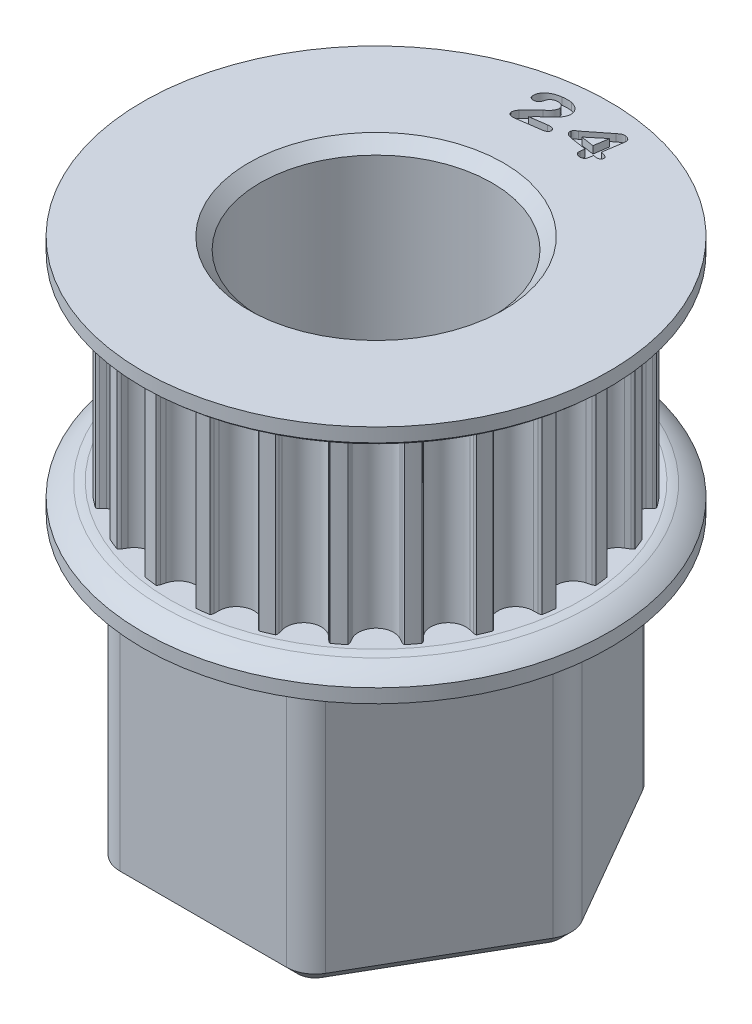
from build123d import *

# Parameters (mm, degrees)
SKETCH1_R                    = 11.078156269
TOOTHOD_DEPTH                = 5.08
TOOTHPROFILE_DEPTH           = 17.469896559
TOOTHPATTERN_COUNT           = 24
BORE_DEPTH                   = 20.343586122
BORE_DEPTH_BACK              = 20.343586122
SKETCH7_R                    = 6.3881
SMALL_TOOTH_COUNT_DEPTH      = 23.472489227
SMALL_TOOTH_COUNT_DEPTH_BACK = 0.4
SKETCH12_R                   = 6.3881
BOSS_EXTRUDE1_DEPTH          = 15.24
FILLET1_R                    = 1.5875
CUT_SWEEP1_PROFILE_R         = 0.3175
FILLET2_R                    = 1.27
CHAMFER2_SIZE                = 0.635
CHAMFER3_SIZE                = 0.635


with BuildPart() as part:
    # Sketch1 → ToothOD (new, symmetric)
    with BuildSketch(Plane(origin=(0, 0, 0), x_dir=(1, 0, 0), z_dir=(0, 1, 0))):
        Circle(SKETCH1_R)
    extrude(amount=TOOTHOD_DEPTH, both=True)

    # Sketch2 → ToothProfile (cut, symmetric)
    with BuildSketch(Plane(origin=(0, 0, 0), x_dir=(1, 0, 0), z_dir=(0, 1, 0))):
        with BuildLine():
            ThreePointArc((-0.937033068, 10.628218265), (-0.590385173, 10.110043655), (0, 9.909756269))
            ThreePointArc((0, 9.909756269), (0.590385173, 10.110043655), (0.937033068, 10.628218265))
            ThreePointArc((0.937033068, 10.628218265), (0.971699064, 10.754329727), (1.007805813, 10.880036269))
            ThreePointArc((1.007805813, 10.880036269), (1.043742495, 10.958436311), (1.100516181, 11.023357495))
            ThreePointArc((1.100516181, 11.023357495), (0, 11.078156269), (-1.100516181, 11.023357495))
            ThreePointArc((-1.100516181, 11.023357495), (-1.043742495, 10.958436311), (-1.007805813, 10.880036269))
            ThreePointArc((-1.007805813, 10.880036269), (-0.971699064, 10.754329727), (-0.937033068, 10.628218265))
        make_face()
    toothprofile = extrude(amount=TOOTHPROFILE_DEPTH, both=True, mode=Mode.SUBTRACT)

    # ToothPattern: ToothProfile ×24 about axis
    toothpattern_axis = Axis((0, 5.08, 0), (0, -1, 0))
    for i in range(1, TOOTHPATTERN_COUNT):
        add(toothprofile.rotate(toothpattern_axis, i * 360 / TOOTHPATTERN_COUNT), mode=Mode.SUBTRACT)

    # Sketch4 → Flange (revolve)
    with BuildSketch(Plane.XY):
        with BuildLine():
            Line((0, -5.08), (11.332156269, -5.08))
            ThreePointArc((11.332156269, -5.08), (11.56180289, -5.115951298), (11.787228598, -5.172637424))
            ThreePointArc((11.787228598, -5.172637424), (12.354957174, -5.454197125), (12.856156269, -5.842))
            Line((12.856156269, -5.842), (12.856156269, -6.604))
            Line((12.856156269, -6.604), (0, -6.604))
            Line((0, -6.604), (0, -5.08))
        make_face()
        with BuildLine():
            Line((12.856156269, 6.604), (12.856156269, 5.842))
            ThreePointArc((12.856156269, 5.842), (12.354957174, 5.454197125), (11.787228598, 5.172637424))
            ThreePointArc((11.787228598, 5.172637424), (11.56180289, 5.115951298), (11.332156269, 5.08))
            Line((11.332156269, 5.08), (0, 5.08))
            Line((0, 5.08), (0, 6.604))
            Line((0, 6.604), (12.856156269, 6.604))
        make_face()
    revolve(axis=Axis((0, 8.0264, 0), (0, -1, 0)))

    # Sketch7 → Bore (cut, two sides: drawn at the far end of the back side and taken through both)
    with BuildSketch(Plane.XZ.offset(-BORE_DEPTH_BACK)):
        Circle(SKETCH7_R)
    extrude(amount=BORE_DEPTH + BORE_DEPTH_BACK, mode=Mode.SUBTRACT)

    # Sketch11 → Small Tooth Count (cut, two sides: drawn at the far end of the back side and taken through both)
    # profile 1 of 2: a face of its own
    with BuildSketch(Plane(origin=(0, 6.604, 0), x_dir=(1, 0, 0), z_dir=(0, 1, 0)).offset(-SMALL_TOOTH_COUNT_DEPTH_BACK)):
        with BuildLine():
            Line((-1.50932721, 9.916837863), (-0.597606116, 10.046764816))
            add(Edge.make_bspline(
                [(-0.597606116, 10.046764816), (-0.571157489, 10.050105826), (-0.52120142, 10.056416311), (-0.449541333, 10.055313599), (-0.385667722, 10.047305308), (-0.330562884, 10.029277348), (-0.28444503, 10.005378402), (-0.249016623, 9.974662726), (-0.224075796, 9.938023746), (-0.217996356, 9.910169852), (-0.214969007, 9.896299582)],
                knots=[0, 0, 0, 0, 1.407436454, 2.658360686, 3.778686155, 4.796186387, 5.707822169, 6.504860125, 7.25547238, 8, 8, 8, 8], degree=3))
            add(Edge.make_bspline(
                [(-0.214969007, 9.896299582), (-0.213936308, 9.883603258), (-0.211851942, 9.857977408), (-0.222454605, 9.819456736), (-0.242047158, 9.78205115), (-0.270462476, 9.745517337), (-0.309742938, 9.712270871), (-0.360197484, 9.685833025), (-0.421026872, 9.665765439), (-0.465453114, 9.658287244), (-0.489110413, 9.654305051)],
                knots=[0, 0, 0, 0, 0.748192561, 1.510127746, 2.320859081, 3.236210595, 4.228876646, 5.33922549, 6.583118088, 8, 8, 8, 8], degree=3))
            Line((-0.489110413, 9.654305051), (-1.858031507, 9.458744894))
            add(Edge.make_bspline(
                [(-1.858031507, 9.458744894), (-1.881812164, 9.456078685), (-1.927114595, 9.450999526), (-1.992824891, 9.455151256), (-2.052190696, 9.468165459), (-2.104274077, 9.490978722), (-2.147742871, 9.521062832), (-2.181559921, 9.557126937), (-2.205078512, 9.598853341), (-2.211523929, 9.629488347), (-2.214772522, 9.644928879)],
                knots=[0, 0, 0, 0, 1.281292524, 2.440877223, 3.513557772, 4.524978182, 5.470507004, 6.329058183, 7.157818661, 8, 8, 8, 8], degree=3))
            add(Edge.make_bspline(
                [(-2.214772522, 9.644928879), (-2.215569805, 9.655797352), (-2.217301044, 9.679397428), (-2.212074679, 9.717481484), (-2.200960176, 9.760321538), (-2.184255907, 9.806310122), (-2.16419242, 9.852762198), (-2.140750929, 9.895489886), (-2.116593563, 9.93417597), (-2.097617179, 9.956478399), (-2.088417444, 9.967290597)],
                knots=[0, 0, 0, 0, 0.737310593, 1.601014737, 2.589839704, 3.735717173, 4.915099845, 6.016891089, 7.038590449, 8, 8, 8, 8], degree=3))
            add(Edge.make_bspline(
                [(-2.088417444, 9.967290597), (-2.052954712, 10.006233814), (-1.984101455, 10.081844663), (-1.882231331, 10.190148309), (-1.78600669, 10.290828012), (-1.70863357, 10.368561764), (-1.650073949, 10.425787839), (-1.610218762, 10.464524742), (-1.573038245, 10.499377239), (-1.539092018, 10.530615679), (-1.508517118, 10.558426697), (-1.480481045, 10.581976657), (-1.45629526, 10.602878662), (-1.440339068, 10.614629857), (-1.432978382, 10.620050754)],
                knots=[0, 0, 0, 0, 2.047788947, 3.975918602, 5.780698357, 7.462358793, 8.239809494, 8.964130096, 9.62319837, 10.221078995, 10.757845781, 11.229820742, 11.644711727, 12, 12, 12, 12], degree=3))
            add(Edge.make_bspline(
                [(-1.432978382, 10.620050754), (-1.411114208, 10.637295005), (-1.368791421, 10.670674943), (-1.309585205, 10.721861713), (-1.257517254, 10.773066677), (-1.210534252, 10.82242143), (-1.17028345, 10.87179307), (-1.135606303, 10.920131703), (-1.107860743, 10.968292082), (-1.08553367, 11.015174114), (-1.069936386, 11.061387106), (-1.059705317, 11.105925046), (-1.056275295, 11.149162831), (-1.058881911, 11.176977588), (-1.060163929, 11.190657785)],
                knots=[0, 0, 0, 0, 1.41082819, 2.730959837, 3.962766903, 5.109764772, 6.181493254, 7.187824709, 8.120338862, 8.994079246, 9.814383323, 10.586481619, 11.304785934, 12, 12, 12, 12], degree=3))
            add(Edge.make_bspline(
                [(-1.060163929, 11.190657785), (-1.062618629, 11.204494899), (-1.06747002, 11.231842127), (-1.083834468, 11.270115654), (-1.105489401, 11.305625195), (-1.133408735, 11.337522246), (-1.166046845, 11.366425296), (-1.203892765, 11.390361143), (-1.245966118, 11.410353932), (-1.292161897, 11.424992006), (-1.340996369, 11.435882109), (-1.391906039, 11.441117217), (-1.44430733, 11.441309423), (-1.479439833, 11.437047814), (-1.497272132, 11.434884738)],
                knots=[0, 0, 0, 0, 0.906920493, 1.792408525, 2.674642041, 3.589913914, 4.525093507, 5.487027952, 6.478087552, 7.532080477, 8.616620183, 9.711251621, 10.838293888, 12, 12, 12, 12], degree=3))
            add(Edge.make_bspline(
                [(-1.497272132, 11.434884738), (-1.514165051, 11.431956836), (-1.547305706, 11.426212856), (-1.594999107, 11.41181417), (-1.63941231, 11.392475804), (-1.680884552, 11.368710631), (-1.719132889, 11.340057857), (-1.753507144, 11.305976261), (-1.785597804, 11.268097526), (-1.803721896, 11.239846839), (-1.812936585, 11.225483566)],
                knots=[0, 0, 0, 0, 1.047578806, 2.055147905, 3.037331254, 4.003491932, 4.971707363, 5.949835577, 6.957651196, 8, 8, 8, 8], degree=3))
            add(Edge.make_bspline(
                [(-1.812936585, 11.225483566), (-1.814458795, 11.221775606), (-1.819020173, 11.210664523), (-1.826430513, 11.187392943), (-1.8363605, 11.151981445), (-1.848825896, 11.106904921), (-1.864197864, 11.057785769), (-1.883498509, 11.010024351), (-1.907843305, 10.967140907), (-1.933918105, 10.926754831), (-1.968424595, 10.891810149), (-2.013254557, 10.864955698), (-2.067652355, 10.844897277), (-2.107752263, 10.83772542), (-2.129047522, 10.833916769)],
                knots=[0, 0, 0, 0, 0.265007539, 0.794108009, 1.613373207, 2.697617163, 3.886602221, 5.01617726, 6.095451393, 7.143719409, 8.187635248, 9.310199435, 10.571567743, 12, 12, 12, 12], degree=3))
            add(Edge.make_bspline(
                [(-2.129047522, 10.833916769), (-2.145702833, 10.832148904), (-2.177842142, 10.828737501), (-2.225347998, 10.833205546), (-2.269895483, 10.844047702), (-2.310724724, 10.862888812), (-2.346516666, 10.888526805), (-2.374439978, 10.921981153), (-2.393798514, 10.962258671), (-2.399679354, 10.991777532), (-2.402742444, 11.007152707)],
                knots=[0, 0, 0, 0, 1.103853878, 2.130077396, 3.133877759, 4.119166359, 5.082634088, 6.017851916, 6.96757965, 8, 8, 8, 8], degree=3))
            add(Edge.make_bspline(
                [(-2.402742444, 11.007152707), (-2.404621818, 11.025443769), (-2.408440344, 11.062607704), (-2.404036406, 11.119951061), (-2.393382933, 11.179126415), (-2.374872021, 11.239758118), (-2.349177564, 11.300687215), (-2.315494278, 11.36032443), (-2.273763975, 11.417744069), (-2.225138897, 11.473717212), (-2.168189831, 11.527075519), (-2.102387044, 11.576589749), (-2.02866634, 11.622983283), (-1.946451016, 11.665537987), (-1.855893746, 11.703375453), (-1.756635021, 11.735560403), (-1.648939306, 11.761335845), (-1.573863538, 11.773374554), (-1.535223304, 11.779570676)],
                knots=[0, 0, 0, 0, 0.686667313, 1.395176401, 2.14217196, 2.933050997, 3.761378171, 4.611517609, 5.489179995, 6.412591937, 7.381608954, 8.40276096, 9.488705709, 10.636721208, 11.862062126, 13.156195851, 14.536341884, 16, 16, 16, 16], degree=3))
            add(Edge.make_bspline(
                [(-1.535223304, 11.779570676), (-1.51098446, 11.782864739), (-1.463484936, 11.789319934), (-1.3931866, 11.795965108), (-1.325279482, 11.800104771), (-1.259746788, 11.801309567), (-1.196738069, 11.800639843), (-1.136249357, 11.797045796), (-1.078284928, 11.79091863), (-1.0406437, 11.784799376), (-1.022212757, 11.781803097)],
                knots=[0, 0, 0, 0, 1.139510729, 2.233036297, 3.288782861, 4.308228055, 5.285958018, 6.223630361, 7.130204615, 8, 8, 8, 8], degree=3))
            add(Edge.make_bspline(
                [(-1.022212757, 11.781803097), (-0.996346238, 11.776001966), (-0.945668387, 11.764636353), (-0.873068597, 11.740276391), (-0.805417719, 11.710781694), (-0.742751011, 11.676450968), (-0.685656039, 11.637533154), (-0.633786844, 11.595223091), (-0.58870652, 11.54841819), (-0.54906255, 11.498825501), (-0.516177347, 11.446357641), (-0.489829112, 11.391805019), (-0.470755505, 11.33520861), (-0.463644085, 11.296287026), (-0.460088929, 11.276829269)],
                knots=[0, 0, 0, 0, 1.184878925, 2.321422417, 3.418236948, 4.481667666, 5.511750754, 6.504540555, 7.469430236, 8.412213537, 9.339242204, 10.232319117, 11.116297388, 12, 12, 12, 12], degree=3))
            add(Edge.make_bspline(
                [(-0.460088929, 11.276829269), (-0.458344915, 11.26151817), (-0.454881571, 11.231112681), (-0.454228176, 11.185416025), (-0.456587369, 11.139957574), (-0.463987312, 11.095046809), (-0.474807198, 11.050442291), (-0.489144725, 11.006067202), (-0.507281058, 10.961900847), (-0.537254061, 10.905276357), (-0.576759476, 10.838655761), (-0.626292967, 10.765363592), (-0.676992982, 10.701276091), (-0.722071621, 10.653855546), (-0.761194236, 10.617845627), (-0.794206933, 10.586849676), (-0.832065984, 10.552066211), (-0.87505434, 10.51382363), (-0.922365044, 10.471389469), (-0.974062376, 10.42482995), (-1.030912184, 10.37483785), (-1.091062336, 10.322368683), (-1.150688874, 10.269172522), (-1.207256163, 10.218149043), (-1.258914453, 10.170234867), (-1.305402401, 10.125022937), (-1.347010294, 10.083115848), (-1.383776929, 10.044108725), (-1.415868177, 10.008409704), (-1.434851705, 9.9849262), (-1.443694007, 9.973987863)],
                knots=[0, 0, 0, 0, 0.764715832, 1.518608056, 2.266281531, 3.021946302, 3.774714963, 4.543561344, 5.335395795, 6.141819471, 7.722191955, 9.179477286, 10.530900026, 11.774914819, 12.423188144, 13.170861619, 14.023369367, 14.975807079, 16.027662526, 17.178935749, 18.430237895, 19.786500845, 21.142119432, 22.397756293, 23.568968093, 24.640267795, 25.617411505, 26.500872375, 27.301724132, 28, 28, 28, 28], degree=3))
            add(Edge.make_bspline(
                [(-1.443694007, 9.973987863), (-1.453364212, 9.963671779), (-1.47330175, 9.942402602), (-1.497081325, 9.925527908), (-1.50932721, 9.916837863)],
                knots=[0, 0, 0, 0, 0.970050127, 2, 2, 2, 2], degree=3))
        make_face()
    # profile 2 of 2: a face of its own
    with BuildSketch(Plane(origin=(0, 6.604, 0), x_dir=(1, 0, 0), z_dir=(0, 1, 0)).offset(-SMALL_TOOTH_COUNT_DEPTH_BACK)):
        with BuildLine():
            Line((1.54875845, 9.694357822), (1.584923685, 9.933226963))
            Line((1.584923685, 9.933226963), (0.682132279, 10.069851181))
            add(Edge.make_bspline(
                [(0.682132279, 10.069851181), (0.667069888, 10.072365675), (0.637833552, 10.077246347), (0.59577177, 10.087058213), (0.55695217, 10.098786908), (0.52087805, 10.111393675), (0.488418367, 10.126838621), (0.458477124, 10.143111023), (0.432269492, 10.162056812), (0.408693626, 10.18212698), (0.38870757, 10.203944717), (0.371885868, 10.226994313), (0.35840571, 10.251290566), (0.348018344, 10.276733106), (0.341320451, 10.303508094), (0.337827643, 10.331370309), (0.337171075, 10.360614092), (0.339714529, 10.380324227), (0.341018216, 10.390426963)],
                knots=[0, 0, 0, 0, 1.388781889, 2.695647554, 3.924835582, 5.076755441, 6.166884665, 7.191145902, 8.171528826, 9.102438726, 10.003031995, 10.85597153, 11.692204285, 12.524262991, 13.348354993, 14.194608087, 15.074618352, 16, 16, 16, 16], degree=3))
            add(Edge.make_bspline(
                [(0.341018216, 10.390426963), (0.343314029, 10.401766071), (0.347905655, 10.424444287), (0.364951704, 10.456369439), (0.388568217, 10.486709873), (0.418275625, 10.515685703), (0.450792773, 10.54325826), (0.483165479, 10.570045891), (0.516726241, 10.593594233), (0.541010266, 10.605208787), (0.553098294, 10.610990244)],
                knots=[0, 0, 0, 0, 0.874989528, 1.749979056, 2.718094681, 3.789673942, 4.896134263, 5.957640263, 6.983360329, 8, 8, 8, 8], degree=3))
            Line((0.553098294, 10.610990244), (1.705027982, 11.518692978))
            add(Edge.make_bspline(
                [(1.705027982, 11.518692978), (1.723363136, 11.532991398), (1.757949305, 11.559962949), (1.808225363, 11.595384396), (1.852746903, 11.624819107), (1.892637113, 11.648787092), (1.932025804, 11.666045934), (1.973483961, 11.675129197), (2.017493428, 11.678705146), (2.047351945, 11.6750505), (2.062661966, 11.673176572)],
                knots=[0, 0, 0, 0, 1.385215562, 2.61297499, 3.66319543, 4.565137817, 5.383713486, 6.211887483, 7.083141318, 8, 8, 8, 8], degree=3))
            add(Edge.make_bspline(
                [(2.062661966, 11.673176572), (2.076257006, 11.671040484), (2.102449413, 11.666925065), (2.139810345, 11.656941366), (2.174575329, 11.646872817), (2.206120926, 11.633628939), (2.234672364, 11.618826973), (2.260956403, 11.602999155), (2.283731023, 11.58450638), (2.303810023, 11.564346874), (2.320102009, 11.541778551), (2.334314126, 11.518050763), (2.345011256, 11.492131061), (2.353022598, 11.464600848), (2.358015704, 11.435084984), (2.359498037, 11.403817064), (2.358831026, 11.370632185), (2.355784412, 11.348116563), (2.354216263, 11.336527353)],
                knots=[0, 0, 0, 0, 1.293804893, 2.49266397, 3.63541932, 4.696405976, 5.704707744, 6.66060036, 7.576904144, 8.458193591, 9.329188293, 10.188967274, 11.054995144, 11.959019234, 12.88214529, 13.86394316, 14.900531759, 16, 16, 16, 16], degree=3))
            Line((2.354216263, 11.336527353), (2.1845522, 10.222102353))
            Line((2.1845522, 10.222102353), (2.207322904, 10.218530478))
            add(Edge.make_bspline(
                [(2.207322904, 10.218530478), (2.232248392, 10.214268879), (2.280202022, 10.206070076), (2.348269361, 10.188595146), (2.409795368, 10.167787516), (2.456229433, 10.147023934), (2.48888784, 10.127893843), (2.509196551, 10.111682906), (2.526056243, 10.093814855), (2.538824571, 10.073635644), (2.547904264, 10.051594759), (2.552635086, 10.027515392), (2.554062763, 10.001786493), (2.552120748, 9.984263558), (2.551115872, 9.975196494)],
                knots=[0, 0, 0, 0, 1.927642278, 3.708550971, 5.352300247, 6.875759797, 7.578383738, 8.232399134, 8.850783688, 9.442669577, 10.04330382, 10.657613479, 11.305395775, 12, 12, 12, 12], degree=3))
            add(Edge.make_bspline(
                [(2.551115872, 9.975196494), (2.547955126, 9.96102685), (2.541797823, 9.933423624), (2.517793864, 9.897447274), (2.483869765, 9.869057778), (2.439811976, 9.848735526), (2.387159558, 9.83647943), (2.326366538, 9.831010515), (2.257659441, 9.832569738), (2.209510712, 9.838837208), (2.184105716, 9.84214415)],
                knots=[0, 0, 0, 0, 0.796932365, 1.552466999, 2.340640896, 3.216672216, 4.208643632, 5.316555866, 6.584118596, 8, 8, 8, 8], degree=3))
            Line((2.184105716, 9.84214415), (2.127848685, 9.850627353))
            Line((2.127848685, 9.850627353), (2.09168345, 9.611758213))
            add(Edge.make_bspline(
                [(2.09168345, 9.611758213), (2.087915831, 9.593695487), (2.080686946, 9.559038758), (2.05877288, 9.511463546), (2.027421046, 9.471942372), (1.987626923, 9.440800936), (1.941248649, 9.417609853), (1.888057705, 9.405099886), (1.829490591, 9.400928089), (1.789087064, 9.405679459), (1.767982279, 9.408161338)],
                knots=[0, 0, 0, 0, 1.023598687, 1.96396612, 2.882860389, 3.801754658, 4.752874875, 5.742353606, 6.820718238, 8, 8, 8, 8], degree=3))
            add(Edge.make_bspline(
                [(1.767982279, 9.408161338), (1.749936329, 9.411515451), (1.715051993, 9.417999234), (1.667376192, 9.438251786), (1.625447447, 9.464339438), (1.590867277, 9.497992309), (1.564133216, 9.53845956), (1.54803808, 9.585677285), (1.542213237, 9.638713459), (1.54650315, 9.675184309), (1.54875845, 9.694357822)],
                knots=[0, 0, 0, 0, 1.075850784, 2.079709954, 3.02358972, 3.963774271, 4.892949688, 5.847308372, 6.868283553, 8, 8, 8, 8], degree=3))
        make_face()
        Polygon((0.929484622, 10.412751181), (1.6416272, 10.304701963), (1.763517435, 11.104801963), align=None, mode=Mode.SUBTRACT)
    extrude(amount=SMALL_TOOTH_COUNT_DEPTH + SMALL_TOOTH_COUNT_DEPTH_BACK, mode=Mode.SUBTRACT)

    # Sketch12 → Boss-Extrude1 (add)
    with BuildSketch(Plane.XZ.offset(6.604)):
        Polygon((5.499261314, -9.525), (10.998522628, 0), (5.499261314, 9.525), (-5.499261314, 9.525), (-10.998522628, 0), (-5.499261314, -9.525), align=None)
        Circle(SKETCH12_R, mode=Mode.SUBTRACT)
    extrude(amount=BOSS_EXTRUDE1_DEPTH)

    # Fillet1
    fillet1_edges = [part.edges().sort_by_distance(p)[0] for p in [
        (-5.499261314, -14.224, 9.525),
        (5.499261314, -14.224, 9.525),
        (10.998522628, -14.224, 0),
        (5.499261314, -14.224, -9.525),
        (-10.998522628, -14.224, 0),
        (-5.499261314, -14.224, -9.525),
    ]]
    fillet(fillet1_edges, radius=FILLET1_R)

    # Cut-Sweep1: sweep along a path in Sketch25
    with BuildLine(Plane.XZ.offset(6.604)) as cut_sweep1_path:
        Line((-4.582717762, -9.525), (4.582717762, -9.525))
        ThreePointArc((4.582717762, -9.525), (5.376467762, -9.312315329), (5.95753309, -8.73125))
        Line((5.95753309, -8.73125), (10.540250852, -0.79375))
        ThreePointArc((10.540250852, -0.79375), (10.752935523, 0), (10.540250852, 0.79375))
        Line((10.540250852, 0.79375), (5.95753309, 8.73125))
        ThreePointArc((5.95753309, 8.73125), (5.376467762, 9.312315329), (4.582717762, 9.525))
        Line((4.582717762, 9.525), (-4.582717762, 9.525))
        ThreePointArc((-4.582717762, 9.525), (-5.376467762, 9.312315329), (-5.95753309, 8.73125))
        Line((-5.95753309, 8.73125), (-10.540250852, 0.79375))
        ThreePointArc((-10.540250852, 0.79375), (-10.752935523, 0), (-10.540250852, -0.79375))
        Line((-10.540250852, -0.79375), (-5.95753309, -8.73125))
        ThreePointArc((-5.95753309, -8.73125), (-5.376467762, -9.312315329), (-4.582717762, -9.525))
    # Cut-Sweep1 profile (on start of the path) → Cut-Sweep1 (sweep, cut)
    with BuildSketch(Plane(origin=(-4.582717762, -6.604, -9.525), x_dir=(0, 0, 1), z_dir=(1, 0, 0))):
        Circle(CUT_SWEEP1_PROFILE_R)
    sweep(path=cut_sweep1_path.line, mode=Mode.SUBTRACT)

    # Fillet2
    fillet2_edges = [part.edges().sort_by_distance(p)[0] for p in [
        (-5.535217762, -6.604, 9.587278394),
        (0, -6.604, 9.8425),
        (5.535217762, -6.604, 9.587278394),
        (8.523855037, -6.604, 4.92125),
        (11.070435523, -6.604, 0),
        (8.523855037, -6.604, -4.92125),
        (5.535217762, -6.604, -9.587278394),
        (0, -6.604, -9.8425),
        (-5.535217762, -6.604, -9.587278394),
        (-8.523855037, -6.604, -4.92125),
        (-11.070435523, -6.604, 0),
        (-10.752935523, -6.9215, 0),
        (-8.248891971, -6.9215, -4.7625),
        (-5.376467762, -6.9215, -9.312315329),
        (0, -6.9215, -9.525),
        (5.376467762, -6.9215, -9.312315329),
        (8.248891971, -6.9215, -4.7625),
        (10.752935523, -6.9215, 0),
        (8.248891971, -6.9215, 4.7625),
        (5.376467762, -6.9215, 9.312315329),
        (0, -6.9215, 9.525),
        (-5.376467762, -6.9215, 9.312315329),
        (-8.523855037, -6.604, 4.92125),
        (-8.248891971, -6.9215, 4.7625),
    ]]
    fillet(fillet2_edges, radius=FILLET2_R)

    # Chamfer2
    chamfer2_edges = [part.edges().sort_by_distance(p)[0] for p in [
        (0, -21.844, -9.525),
        (5.376467762, -21.844, -9.312315329),
        (-5.376467762, -21.844, -9.312315329),
        (8.248891971, -21.844, -4.7625),
        (-8.248891971, -21.844, -4.7625),
        (10.752935523, -21.844, 0),
        (-10.752935523, -21.844, 0),
        (8.248891971, -21.844, 4.7625),
        (-8.248891971, -21.844, 4.7625),
        (5.376467762, -21.844, 9.312315329),
        (-5.376467762, -21.844, 9.312315329),
        (0, -21.844, 9.525),
    ]]
    chamfer(chamfer2_edges, length=CHAMFER2_SIZE)

    # Chamfer3
    chamfer3_edges = [part.edges().sort_by_distance(p)[0] for p in [
        (-6.3881, -21.844, 0),
        (-6.3881, 6.604, 0),
    ]]
    chamfer(chamfer3_edges, length=CHAMFER3_SIZE)


solid = part.part
